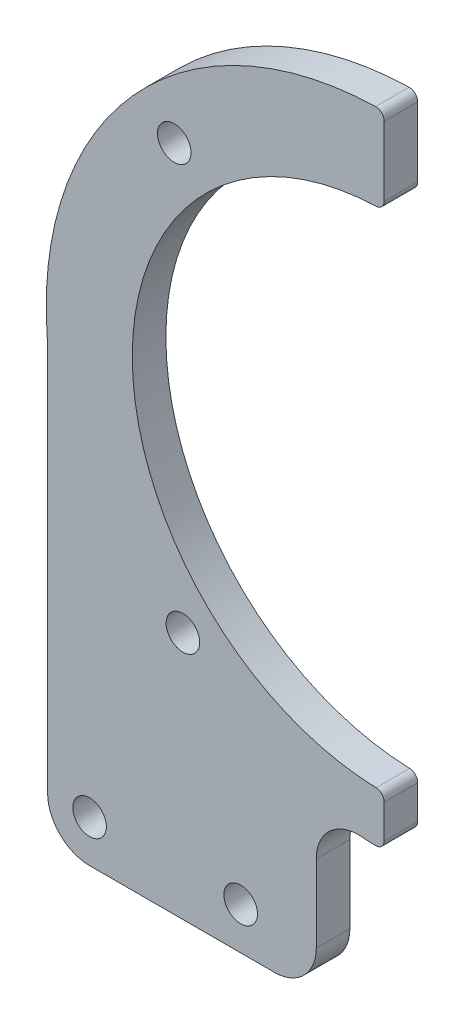
from build123d import *

# Parameters (mm, degrees)
SKETCH1_R           = 2
BOSS_EXTRUDE1_DEPTH = 4
FILLET10_R          = 1
FILLET11_R          = 10
FILLET12_R          = 5
FILLET13_R          = 5
FILLET14_R          = 5
SKETCH2_R           = 2
CUT_EXTRUDE1_DEPTH  = 20


with BuildPart() as part:
    # Sketch1 → Boss-Extrude1 (new body)
    with BuildSketch(Plane.XY):
        with BuildLine():
            Line((-5, -5), (-5, 46.428571429))
            ThreePointArc((-5, 46.428571429), (5.360662074, 77.221028176), (35.086282243, 90.332329282))
            Line((35.086282243, 90.332329282), (35.086282243, 80.08008038))
            ThreePointArc((35.086282243, 80.08008038), (5.086282243, 50.08008038), (35.086282243, 20.08008038))
            Line((35.086282243, 20.08008038), (35.086282243, 14.08008038))
            ThreePointArc((35.086282243, 14.08008038), (31.017062028, 14.31079961), (27, 15))
            Line((27, 15), (27, -5))
            Line((27, -5), (-5, -5))
        make_face()
        Circle(SKETCH1_R, mode=Mode.SUBTRACT)
        with Locations((18, 0)):
            Circle(SKETCH1_R, mode=Mode.SUBTRACT)
    extrude(amount=BOSS_EXTRUDE1_DEPTH)

    # Fillet10
    fillet10_edges = [part.edges().sort_by_distance(p)[0] for p in [
        (35.086282243, 90.332329282, 2),
        (35.086282243, 80.08008038, 2),
        (35.086282243, 20.08008038, 2),
        (35.086282243, 14.08008038, 2),
    ]]
    fillet(fillet10_edges, radius=FILLET10_R)

    # Fillet11
    # the kernel refuses this fillet: 10 mm, written as the material it adds along each edge
    with BuildSketch(Plane(origin=(-5, 46.428571429, 0), x_dir=(-0.08596186737445177, 0.996298427860597, 0), z_dir=(0, 0, 1))) as fillet11_piece_1:
        with BuildLine():
            CenterArc((0.431926178, 9.999886119), FILLET11_R, 265.068661729, 4.657897264)
            Line((-0.427692496, 0.03690184), (0, 0))
            ThreePointArc((0, 0), (0.19210095, 0.000458397), (0.3842019, 0))
        make_face()
    extrude(amount=4)

    # Fillet12
    fillet12_edges = [part.edges().sort_by_distance(p)[0] for p in [
        (-5, -5, 2),
    ]]
    fillet(fillet12_edges, radius=FILLET12_R)

    # Fillet13
    fillet13_edges = [part.edges().sort_by_distance(p)[0] for p in [
        (27, -5, 2),
    ]]
    fillet(fillet13_edges, radius=FILLET13_R)

    # Fillet14
    fillet14_edges = [part.edges().sort_by_distance(p)[0] for p in [
        (27, 15, 2),
    ]]
    fillet(fillet14_edges, radius=FILLET14_R)

    # Sketch2 → Cut-Extrude1 (cut)
    with BuildSketch(Plane.XY.offset(4)):
        with Locations((10.086282243, 74.574977808)):
            Circle(SKETCH2_R)
        with Locations((11.117766586, 24.574977808)):
            Circle(SKETCH2_R)
    extrude(amount=-CUT_EXTRUDE1_DEPTH, mode=Mode.SUBTRACT)


solid = part.part
